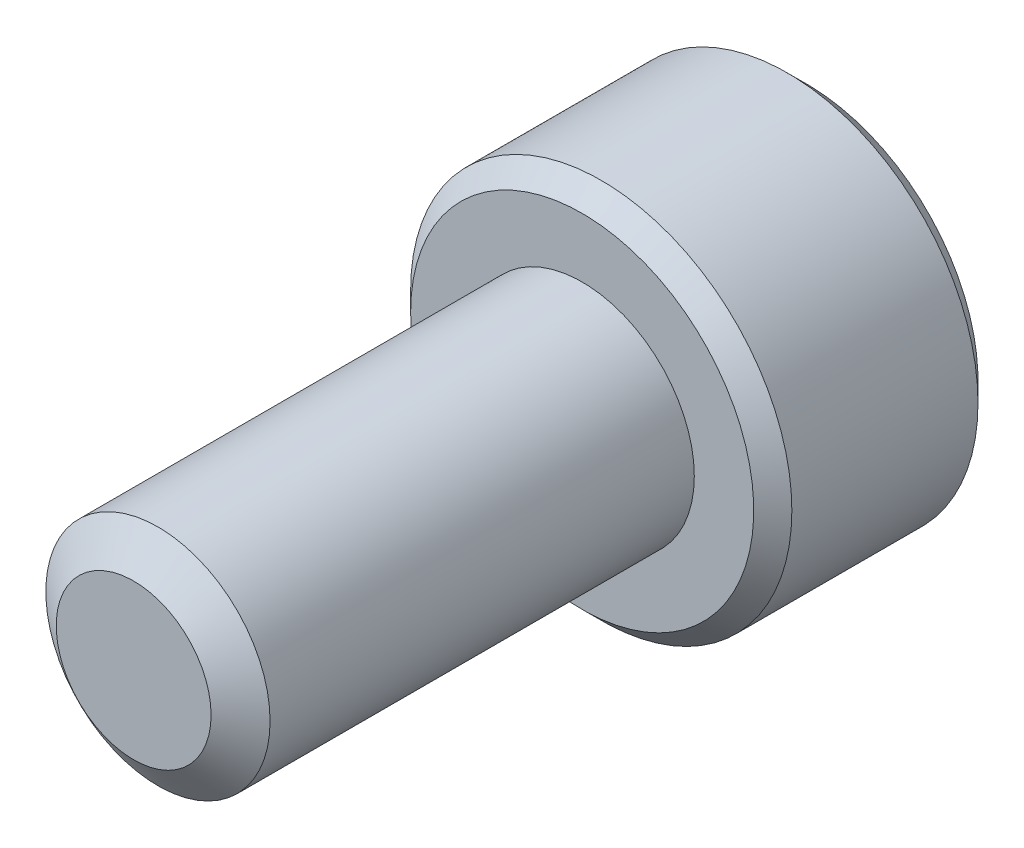
from build123d import *

# Parameters (mm, degrees)
SKETCH1_R          = 2.5
EXTRUDE1_DEPTH     = 10
SKETCH6_R          = 4.25
EXTRUDE2_DEPTH     = 5
CUT_EXTRUDE1_DEPTH = 3
CHAMFER1_SIZE      = 0.425


with BuildPart() as part:
    # Sketch1 → Extrude1 (new body)
    with BuildSketch(Plane.XY):
        Circle(SKETCH1_R)
    extrude(amount=-EXTRUDE1_DEPTH)

    # Sketch4 → Cut-Revolve1 (revolve, cut)
    with BuildSketch(Plane(origin=(0, 0, 0), x_dir=(0, 0, -1), z_dir=(1, 0, 0))):
        Polygon((0.541691224, 2.5), (0, 1.726384758), (0, 2.5), align=None)
    revolve(axis=Axis((0, 0, 0), (0, 0, -1)), mode=Mode.SUBTRACT)

    # Sketch6 → Extrude2 (add)
    with BuildSketch(Plane(origin=(0, 0, -10), x_dir=(-1, 0, 0), z_dir=(0, 0, -1))):
        Circle(SKETCH6_R)
    extrude(amount=EXTRUDE2_DEPTH)

    # Sketch7 → Cut-Extrude1 (cut)
    with BuildSketch(Plane(origin=(0, 0, -15), x_dir=(-1, 0, 0), z_dir=(0, 0, -1))):
        Polygon((0, 2.309401077), (-2, 1.154700538), (-2, -1.154700538), (0, -2.309401077), (2, -1.154700538), (2, 1.154700538), align=None)
    extrude(amount=-CUT_EXTRUDE1_DEPTH, mode=Mode.SUBTRACT)

    # Cut-Extrude2 cone 1 section (through the dimple's axis) → Cut-Extrude2 (revolve, cut)
    with BuildSketch(Plane(origin=(0, 0, -15), x_dir=(0, 1, 0), z_dir=(1, 0, 0))):
        Polygon((0, 0), (2.309401077, 0), (0, 2.309401077), align=None)
    revolve(axis=Axis((0, 0, -15), (0, 0, 1)), mode=Mode.SUBTRACT)

    # Chamfer1
    chamfer1_edges = [part.edges().sort_by_distance(p)[0] for p in [
        (4.25, 0, -15),
        (4.25, 0, -10),
    ]]
    chamfer(chamfer1_edges, length=CHAMFER1_SIZE)


solid = part.part
